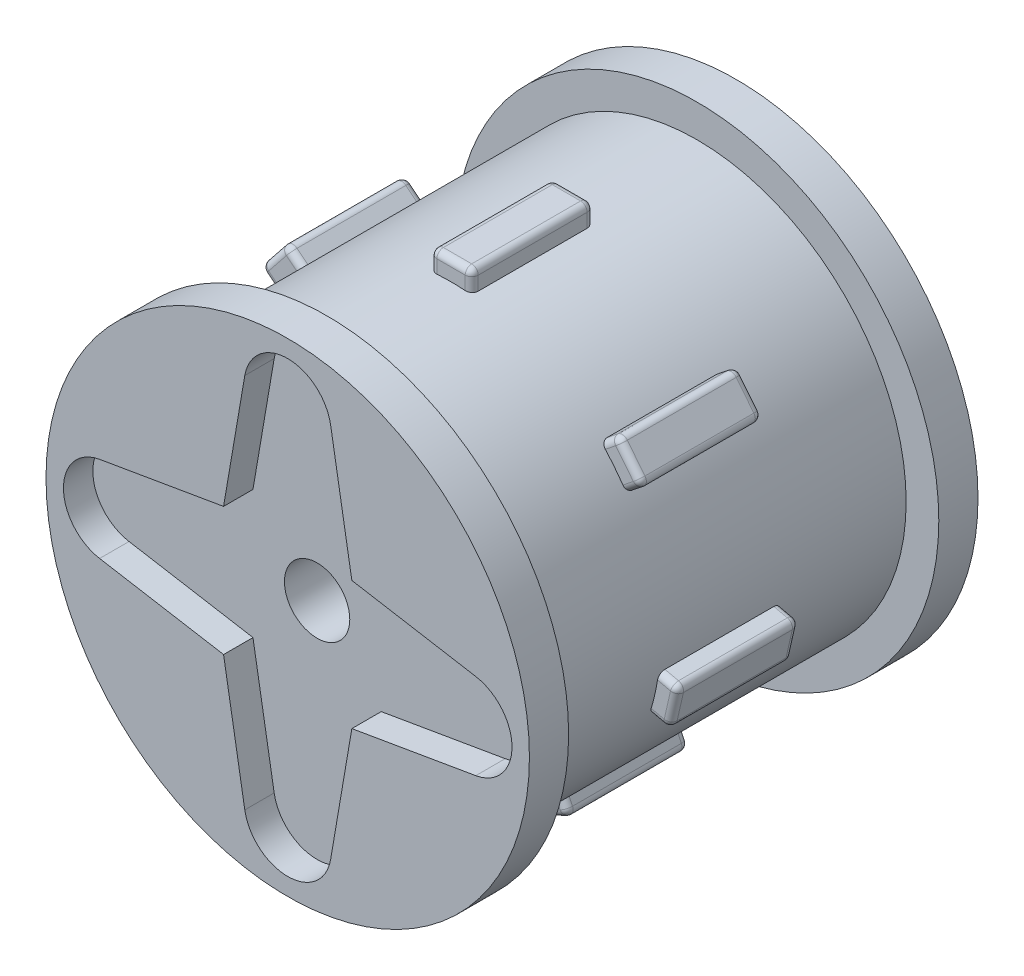
from build123d import *

# Parameters (mm, degrees)
AUFSATZ_LINEAR_AUSTRAGEN1_DEPTH      = 10.3
AUFSATZ_LINEAR_AUSTRAGEN1_DEPTH_BACK = 10.3
SKIZZE1_R                            = 9.6
SKIZZE2_R                            = 11.1
AUFSATZ_LINEAR_AUSTRAGEN2_DEPTH      = 1.8
AUFSATZ_LINEAR_START                 = -1.8
SKIZZE3_R                            = 11.1
AUFSATZ_LINEAR_AUSTRAGEN3_DEPTH      = 1.8
SCHNITT_LINEAR_AUSTRAGEN1_DEPTH      = 1.35
KREISMUSTER1_COUNT                   = 4
SKIZZE9_R                            = 1.5
SCHNITT_LINEAR_AUSTRAGEN2_DEPTH      = 25.839132433
SKIZZE11_W                           = 1.9
SKIZZE11_H                           = 1.78
AUFSATZ_LINEAR_AUSTRAGEN4_DEPTH      = 2.8
KREISMUSTER2_COUNT                   = 7
VERRUNDUNG1_R                        = 0.3


with BuildPart() as part:
    # Skizze1 → Aufsatz-Linear austragen1 (new, two sides: drawn at the far end of the back side and taken through both)
    with BuildSketch(Plane.XY.offset(-AUFSATZ_LINEAR_AUSTRAGEN1_DEPTH_BACK)):
        Circle(SKIZZE1_R)
    extrude(amount=AUFSATZ_LINEAR_AUSTRAGEN1_DEPTH + AUFSATZ_LINEAR_AUSTRAGEN1_DEPTH_BACK)

    # Skizze2 → Aufsatz-Linear austragen2 (add)
    with BuildSketch(Plane.XY.offset(10.3)):
        Circle(SKIZZE2_R)
    extrude(amount=-AUFSATZ_LINEAR_AUSTRAGEN2_DEPTH)

    # Skizze3 → Aufsatz-Linear austragen3 (add)
    with BuildSketch(Plane(origin=(0, 0, -10.3), x_dir=(-1, 0, 0), z_dir=(0, 0, -1)).offset(AUFSATZ_LINEAR_START)):
        Circle(SKIZZE3_R)
    extrude(amount=AUFSATZ_LINEAR_AUSTRAGEN3_DEPTH)

    # Skizze4 → Schnitt-Linear austragen1 (cut)
    with BuildSketch(Plane.XY.offset(10.3)):
        with BuildLine():
            Line((-1.971343548, 8.637349398), (-3.351284031, 0.573493976))
            ThreePointArc((-3.351284031, 0.573493976), (0, -3.4), (3.351284031, 0.573493976))
            Line((3.351284031, 0.573493976), (1.971343548, 8.637349398))
            ThreePointArc((1.971343548, 8.637349398), (0, 10.3), (-1.971343548, 8.637349398))
        make_face()
    schnitt_linear_austragen1 = extrude(amount=-SCHNITT_LINEAR_AUSTRAGEN1_DEPTH, mode=Mode.SUBTRACT)

    # Kreismuster1: Schnitt-Linear austragen1 ×4 about axis
    kreismuster1_axis = Axis((0, 0, -10.3), (0, 0, 1))
    for i in range(1, KREISMUSTER1_COUNT):
        add(schnitt_linear_austragen1.rotate(kreismuster1_axis, i * 360 / KREISMUSTER1_COUNT), mode=Mode.SUBTRACT)

    # Skizze8 → Schnitt-Rotation1 (revolve, cut)
    with BuildSketch(Plane(origin=(0, 0, 0), x_dir=(0, 0, -1), z_dir=(1, 0, 0))):
        Polygon((10.3, 0), (10.3, 8), (8.5, 8), (-6.941131283, 3.465370119), (-6.45, 0), align=None)
    revolve(axis=Axis((0, 0, -10.3), (0, 0, 1)), mode=Mode.SUBTRACT)

    # Skizze9 → Schnitt-Linear austragen2 (cut, through all)
    with BuildSketch(Plane.XY.offset(8.95)):
        Circle(SKIZZE9_R)
    extrude(amount=-SCHNITT_LINEAR_AUSTRAGEN2_DEPTH, mode=Mode.SUBTRACT)

    # Skizze11 → Aufsatz-Linear austragen4 (add, symmetric)
    with BuildSketch(Plane(origin=(0, 0, 0), x_dir=(-1, 0, 0), z_dir=(0, 0, -1))):
        with Locations((0, 9.6)):
            Rectangle(SKIZZE11_W, SKIZZE11_H)
    aufsatz_linear_austragen4 = extrude(amount=AUFSATZ_LINEAR_AUSTRAGEN4_DEPTH, both=True)

    # Kreismuster2: Aufsatz-Linear austragen4 ×7 about axis
    kreismuster2_axis = Axis((0, 0, -10.3), (0, 0, 1))
    for i in range(1, KREISMUSTER2_COUNT):
        add(aufsatz_linear_austragen4.rotate(kreismuster2_axis, i * 360 / KREISMUSTER2_COUNT))

    # Verrundung1
    verrundung1_edges = [part.edges().sort_by_distance(p)[0] for p in [
        (8.201412251, 6.540408021, 2.8),
        (7.609096939, 7.28314793, 0),
        (8.201412251, 6.540408021, -2.8),
        (8.793727563, 5.797668113, 0),
        (-8.42739227, 5.505525466, 2.8),
        (-7.242761647, 6.991005282, 2.8),
        (-7.242761647, 6.991005282, -2.8),
        (-8.42739227, 5.505525466, -2.8),
        (-9.558786273, -3.15616161, -2.8),
        (-9.981576048, -1.303798577, -2.8),
        (-9.558786273, -3.15616161, 2.8),
        (-9.981576048, -1.303798577, 2.8),
        (-5.204060098, -8.616815515, -2.8),
        (-3.492219249, -9.44119462, -2.8),
        (-3.492219249, -9.44119462, 2.8),
        (-5.204060098, -8.616815515, 2.8),
        (5.204060098, -8.616815515, 2.8),
        (3.492219249, -9.44119462, 2.8),
        (3.492219249, -9.44119462, -2.8),
        (5.204060098, -8.616815515, -2.8),
        (9.558786273, -3.15616161, 2.8),
        (9.558786273, -3.15616161, -2.8),
        (9.981576048, -1.303798577, 2.8),
        (9.981576048, -1.303798577, -2.8),
        (8.42739227, 5.505525466, 2.8),
        (8.42739227, 5.505525466, -2.8),
        (7.242761647, 6.991005282, -2.8),
        (7.242761647, 6.991005282, 2.8),
        (0.95, 10.021439574, 2.8),
        (0.95, 10.021439574, -2.8),
        (-0.95, 10.021439574, -2.8),
        (-0.95, 10.021439574, 2.8),
        (10.438388686, -1.408063081, 0),
        (10.226993799, -2.334244597, 2.8),
        (10.226993799, -2.334244597, -2.8),
        (10.015598912, -3.260426114, 0),
        (4.551440423, -9.451163424, 2.8),
        (4.551440423, -9.451163424, -2.8),
        (5.407360848, -9.038973872, 0),
        (3.695519999, -9.863352976, 0),
        (-4.551440423, -9.451163424, 2.8),
        (-4.551440423, -9.451163424, -2.8),
        (-5.407360848, -9.038973872, 0),
        (-3.695519999, -9.863352976, 0),
        (-10.226993799, -2.334244597, 2.8),
        (-10.226993799, -2.334244597, -2.8),
        (-10.015598912, -3.260426114, 0),
        (-10.438388686, -1.408063081, 0),
        (-8.201412251, 6.540408021, -2.8),
        (-8.201412251, 6.540408021, 2.8),
        (-8.793727563, 5.797668113, 0),
        (-7.609096939, 7.28314793, 0),
        (0, 10.49, -2.8),
        (0, 10.49, 2.8),
        (0.95, 10.49, 0),
        (-0.95, 10.49, 0),
    ]]
    fillet(verrundung1_edges, radius=VERRUNDUNG1_R)


solid = part.part
